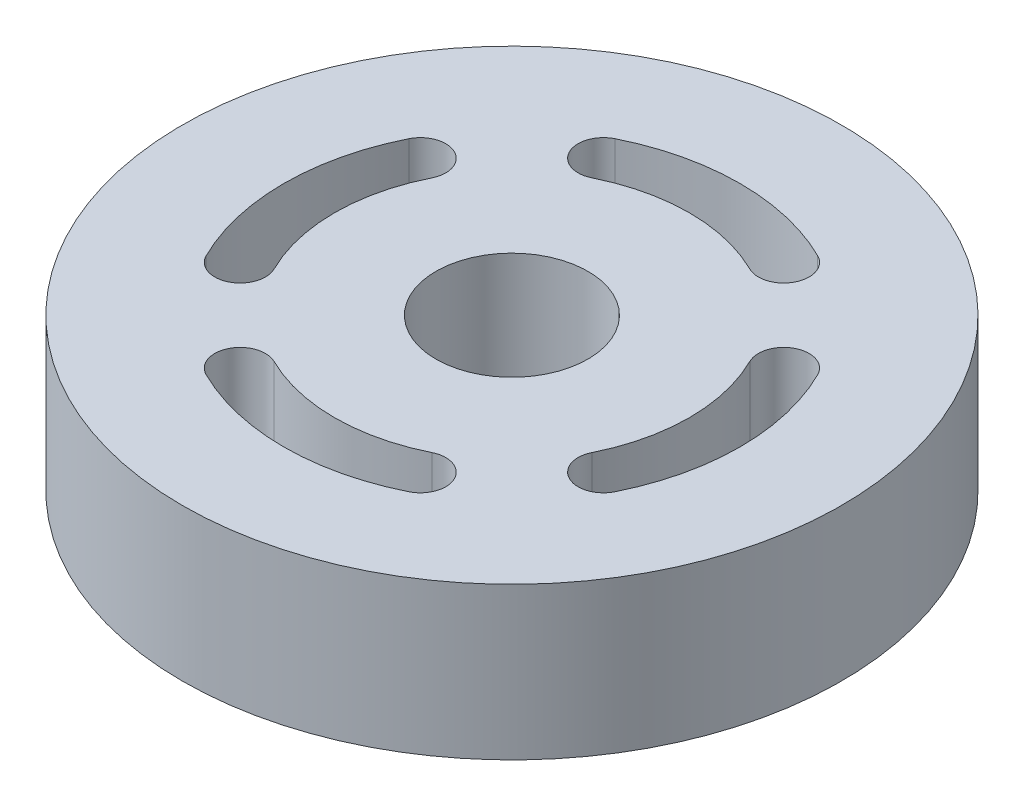
from build123d import *

# Parameters (mm, degrees)
SKETCH1_R           = 13
SKETCH1_R_2         = 3
BOSS_EXTRUDE1_DEPTH = 6
CIRPATTERN1_DEPTH   = 6


# Read off the part's stored shape, not the designer's step: CirPattern1
with BuildPart() as part:
    # Sketch1 → Boss-Extrude1 (new body)
    with BuildSketch(Plane(origin=(0, 0, 0), x_dir=(1, 0, 0), z_dir=(0, 1, 0))):
        with Locations(Location((0, 0, 0), (0, 0, 270))):
            Circle(SKETCH1_R)
        with Locations(Location((0, 0, 0), (0, 0, 270))):
            Circle(SKETCH1_R_2, mode=Mode.SUBTRACT)
        with BuildLine():
            ThreePointArc((-3.111111111, 6.270644915), (-1.597730514, 6.815222462), (0, 7))
            ThreePointArc((0, 7), (1.597730514, 6.815222462), (3.111111111, 6.270644915))
            ThreePointArc((3.111111111, 6.270644915), (4.451361972, 6.722006887), (4, 8.062257748))
            ThreePointArc((4, 8.062257748), (2.054224947, 8.762428879), (0, 9))
            ThreePointArc((0, 9), (-2.054224947, 8.762428879), (-4, 8.062257748))
            ThreePointArc((-4, 8.062257748), (-4.451361972, 6.722006887), (-3.111111111, 6.270644915))
        make_face(mode=Mode.SUBTRACT)
    extrude(amount=BOSS_EXTRUDE1_DEPTH)

    # CirPattern1 outline → CirPattern1 (cut)
    with BuildSketch(Plane(origin=(0, 0, 0), x_dir=(1, 0, 0), z_dir=(0, 1, 0))):
        with BuildLine():
            ThreePointArc((8.062257748, 4), (6.722006887, 4.451361972), (6.270644915, 3.111111111))
            ThreePointArc((6.270644915, 3.111111111), (7, 0), (6.270644915, -3.111111111))
            ThreePointArc((6.270644915, -3.111111111), (6.722006887, -4.451361972), (8.062257748, -4))
            ThreePointArc((8.062257748, -4), (9, 0), (8.062257748, 4))
        make_face()
        with BuildLine():
            ThreePointArc((4, -8.062257748), (4.451361972, -6.722006887), (3.111111111, -6.270644915))
            ThreePointArc((3.111111111, -6.270644915), (0, -7), (-3.111111111, -6.270644915))
            ThreePointArc((-3.111111111, -6.270644915), (-4.451361972, -6.722006887), (-4, -8.062257748))
            ThreePointArc((-4, -8.062257748), (0, -9), (4, -8.062257748))
        make_face()
        with BuildLine():
            ThreePointArc((-8.062257748, -4), (-6.722006887, -4.451361972), (-6.270644915, -3.111111111))
            ThreePointArc((-6.270644915, -3.111111111), (-7, 0), (-6.270644915, 3.111111111))
            ThreePointArc((-6.270644915, 3.111111111), (-6.722006887, 4.451361972), (-8.062257748, 4))
            ThreePointArc((-8.062257748, 4), (-9, 0), (-8.062257748, -4))
        make_face()
    extrude(amount=CIRPATTERN1_DEPTH, mode=Mode.SUBTRACT)


solid = part.part
